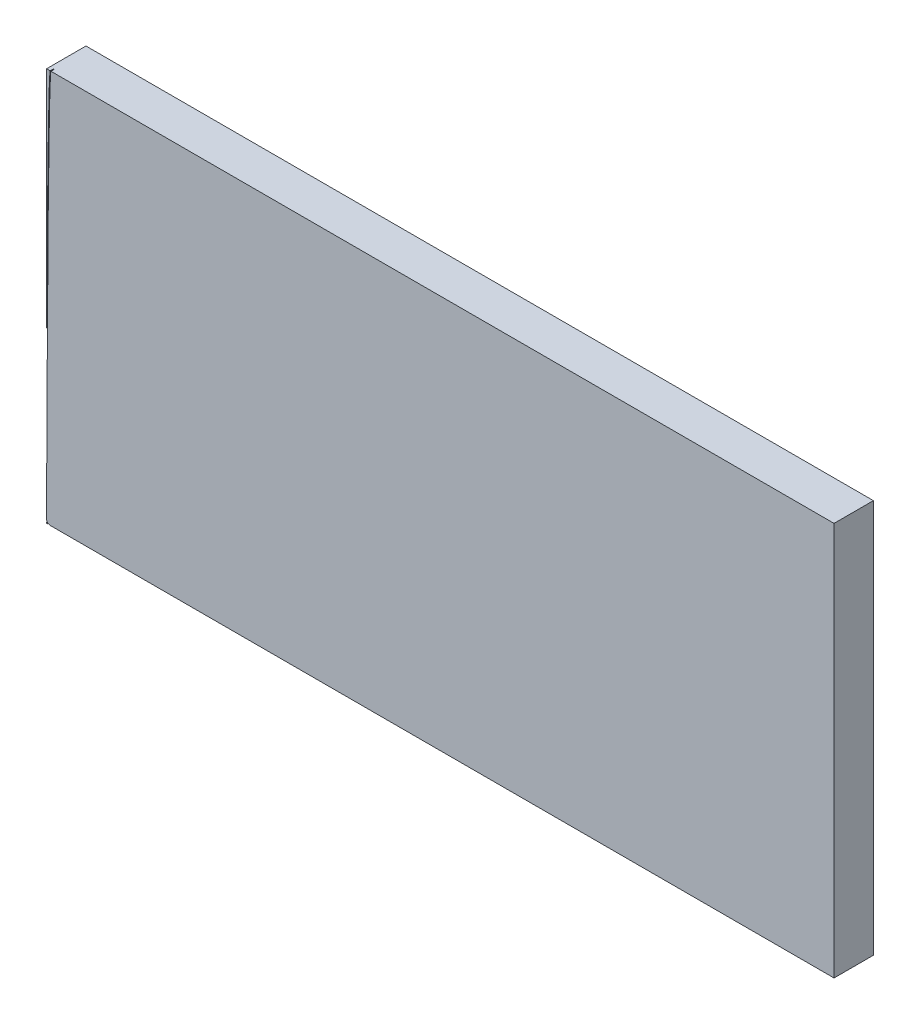
from build123d import *

# Parameters (mm, degrees)
SKETCH2_W               = 2540
SKETCH2_H               = 1270
BOSS_EXTRUDE1_DEPTH     = 127
CUT_EXTRUDE_THIN7_START = -10.16
CUT_EXTRUDE_THIN7_DEPTH = 10.16


# Read off the part's stored shape, not the designer's step: Cut-Extrude-Thin7
with BuildPart() as part:
    # Sketch2 → Boss-Extrude1 (new body)
    with BuildSketch(Plane.XY):
        with Locations((1213.394285714, 608.874285714)):
            Rectangle(SKETCH2_W, SKETCH2_H)
    extrude(amount=BOSS_EXTRUDE1_DEPTH)

    # Cut-Extrude-Thin7 outline → Cut-Extrude-Thin7 (cut)
    with BuildSketch(Plane.XY.offset(127).offset(CUT_EXTRUDE_THIN7_START)):
        with BuildLine():
            Line((-56.605714286, -12.298264237), (-56.605714286, -22.600135555))
            add(Edge.make_bspline(
                [(-56.605714286, -22.600135555), (-56.222595532, -23.177940395), (-55.789824429, -23.723358369), (-54.621251066, -24.947308754), (-53.835801705, -25.583360111), (-52.965066872, -26.125714295)],
                knots=[0.415422097, 0.415422097, 0.415422097, 0.415422097, 0.5, 0.5, 0.620302006, 0.620302006, 0.620302006, 0.620302006], degree=3))
            Line((-52.965066872, -26.125714295), (-42.301285071, -26.125714286))
            add(Edge.make_bspline(
                [(-56.605714286, -12.298264237), (-56.572762187, -21.137617087), (-53.045670494, -25.98669824), (-42.301285071, -26.125714286)],
                knots=[0, 0, 0, 0, 1, 1, 1, 1], degree=3))
        make_face()
        with BuildLine():
            Line((-56.605714286, 519.524275061), (-56.605714288, 28.771147167))
            add(Edge.make_bspline(
                [(-42.301285071, 1243.874285714), (-51.75315576, 1243.743654698), (-56.433053692, 122.584401155), (-56.605714288, 28.771147167)],
                knots=[0, 0, 0, 0, 0.963079213, 0.963079213, 0.963079213, 0.963079213], degree=3))
            Line((-42.301285071, 1243.874285714), (-45.149377592, 1243.874285724))
            add(Edge.make_bspline(
                [(-45.149377592, 1243.874285724), (-45.172892669, 1243.792956079), (-45.19510448, 1243.711148911), (-45.317669219, 1243.237343993), (-45.403042669, 1242.815848994), (-45.568694933, 1241.856029834), (-45.647658785, 1241.319762305), (-45.880529985, 1239.521000622), (-46.030221772, 1238.068360897), (-46.326025387, 1234.640128323), (-46.471737542, 1232.665915968), (-46.904334267, 1225.977209037), (-47.186617939, 1220.49661804), (-47.740926489, 1207.621310865), (-48.012846197, 1200.227338063), (-49.347176032, 1158.83150694), (-50.333944851, 1111.5479368), (-53.056891367, 941.226989356), (-54.555044994, 789.729621863), (-56.050439857, 598.211796401), (-56.338672434, 558.546955358), (-56.605714286, 519.524275061)],
                knots=[0.013961909, 0.013961909, 0.013961909, 0.013961909, 0.015625, 0.015625, 0.0234375, 0.0234375, 0.03125, 0.03125, 0.046875, 0.046875, 0.0625, 0.0625, 0.09375, 0.09375, 0.125, 0.125, 0.25, 0.25, 0.5, 0.5, 0.565247658, 0.565247658, 0.565247658, 0.565247658], degree=3))
        make_face()
    extrude(amount=CUT_EXTRUDE_THIN7_DEPTH, mode=Mode.SUBTRACT)


solid = part.part
